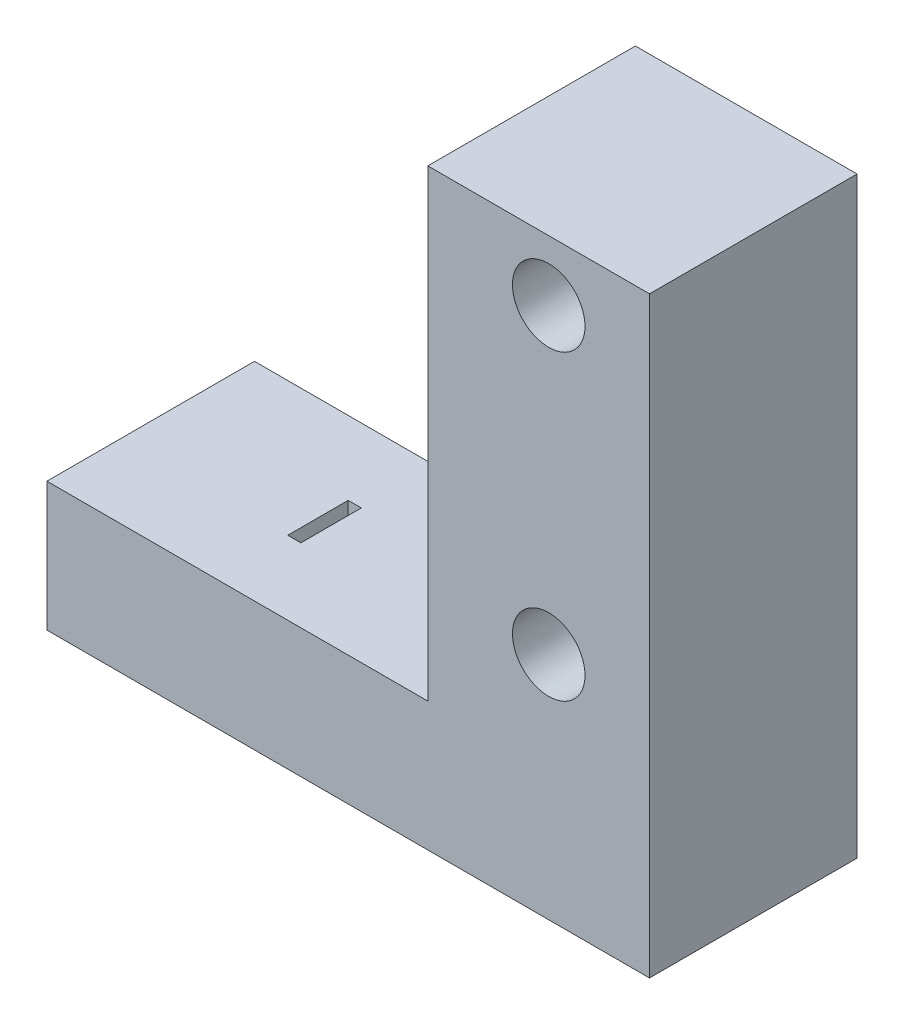
from build123d import *

# Parameters (mm, degrees)
SKETCH1_W            = 29.9
SKETCH1_H            = 10.3
SKETCH1_R            = 2.4
BOSS_EXTRUDE1_DEPTH  = 30
BOSS_EXTRUDE3_START  = -2
SKETCH4_W            = 29.9
SKETCH4_H            = 10.3
BOSS_EXTRUDE3_DEPTH  = 28
SKETCH2_W            = 18.9
SKETCH2_H            = 23
CUT_EXTRUDE1_DEPTH   = 38.631801711
SKETCH3_W            = 0.65
SKETCH3_H            = 3
CUT_EXTRUDE2_DEPTH   = 37.559335333
M3_CLEARANCE_HOLE1_D = 3.6
FILLET1_R            = 1.5
CHAMFER1_SIZE        = 0.6


with BuildPart() as part:
    # Sketch1 → Boss-Extrude1 (new body)
    with BuildSketch(Plane(origin=(0, 0, 0), x_dir=(1, 0, 0), z_dir=(0, 1, 0))):
        with Locations((-5.3, 0)):
            Rectangle(SKETCH1_W, SKETCH1_H)
        with Locations(Location((0, 0, 0), (0, 0, 270))):
            Circle(SKETCH1_R, mode=Mode.SUBTRACT)
        with Locations(Location((-14.25, 0, 0), (0, 0, 270))):
            Circle(SKETCH1_R, mode=Mode.SUBTRACT)
    extrude(amount=BOSS_EXTRUDE1_DEPTH)

    # Sketch4 → Boss-Extrude3 (add)
    with BuildSketch(Plane.XZ.offset(BOSS_EXTRUDE3_START)):
        with Locations((-5.3, 0)):
            Rectangle(SKETCH4_W, SKETCH4_H)
    extrude(amount=-BOSS_EXTRUDE3_DEPTH)

    # Sketch2 → Cut-Extrude1 (cut, through all)
    with BuildSketch(Plane.XY.offset(5.15)):
        with Locations((-10.8, 18.5)):
            Rectangle(SKETCH2_W, SKETCH2_H)
    extrude(amount=-CUT_EXTRUDE1_DEPTH, mode=Mode.SUBTRACT)

    # Sketch3 → Cut-Extrude2 (cut, through all)
    with BuildSketch(Plane.XZ):
        with Locations((-11.625, 0)):
            Rectangle(SKETCH3_W, SKETCH3_H)
        with Locations((-2.625, 0)):
            Rectangle(SKETCH3_W, SKETCH3_H)
    extrude(amount=-CUT_EXTRUDE2_DEPTH, mode=Mode.SUBTRACT)

    # M3 Clearance Hole1 (through all)
    with Locations(Plane.XY.offset(5.15)):
        with Locations((4.65, 12), (4.65, 27)):
            Hole(M3_CLEARANCE_HOLE1_D / 2)

    # Fillet1
    # the kernel refuses this fillet: 1.5 mm, written as the material it takes off along each edge
    with BuildSketch(Plane(origin=(-2.3, 2, 0.68556546), x_dir=(0.5486256089659476, 0, 0.8360681438655243), z_dir=(0, -1, 0)), Plane(origin=(-11.95, 2, -0.68556546), x_dir=(-0.5486256089659476, 0, -0.8360681438655244), z_dir=(0, -1, 0))) as fillet1_piece_1:
        with BuildLine():
            CenterArc((1.80773108, 1.436922187), FILLET1_R, 221.305086591, 32.01998054)
            Line((0.680922774, 0.446819645), (0, 0))
            ThreePointArc((0, 0), (0.688659459, 0.100924501), (1.377318918, 0))
        make_face()
    extrude(amount=5.443297295, mode=Mode.SUBTRACT)
    with BuildSketch(Plane(origin=(-2.3, 2, -0.68556546), x_dir=(0.5486256089659476, 0, -0.8360681438655245), z_dir=(0, -1, 0)), Plane(origin=(-11.95, 2, 0.68556546), x_dir=(-0.5486256089659488, 0, 0.8360681438655235), z_dir=(0, -1, 0))) as fillet1_piece_2:
        with BuildLine():
            CenterArc((1.80773108, -1.436922187), FILLET1_R, 106.67493287, 32.01998054)
            Line((0.680922774, -0.446819645), (0, 0))
            ThreePointArc((0, 0), (0.688659459, -0.100924501), (1.377318918, 0))
        make_face()
    extrude(amount=5.443297295, mode=Mode.SUBTRACT)

    # Chamfer1
    chamfer1_edges = [part.edges().sort_by_distance(p)[0] for p in [
        (2.4, 0, 0),
        (-16.65, 0, 0),
        (-12.351519212, 0, 1.61541677),
        (-12.351519212, 0, -1.61541677),
        (-1.898480788, 0, 1.61541677),
        (-1.898480788, 0, -1.61541677),
        (-5.3, 0, -5.15),
        (9.65, 0, 0),
        (-5.3, 0, 5.15),
        (-20.25, 0, 0),
        (-11.625, 0, -1.5),
        (-11.3, 0, 0),
        (-11.625, 0, 1.5),
        (-2.625, 0, 1.5),
        (-2.95, 0, 0),
        (-2.625, 0, -1.5),
    ]]
    chamfer(chamfer1_edges, length=CHAMFER1_SIZE)


solid = part.part
